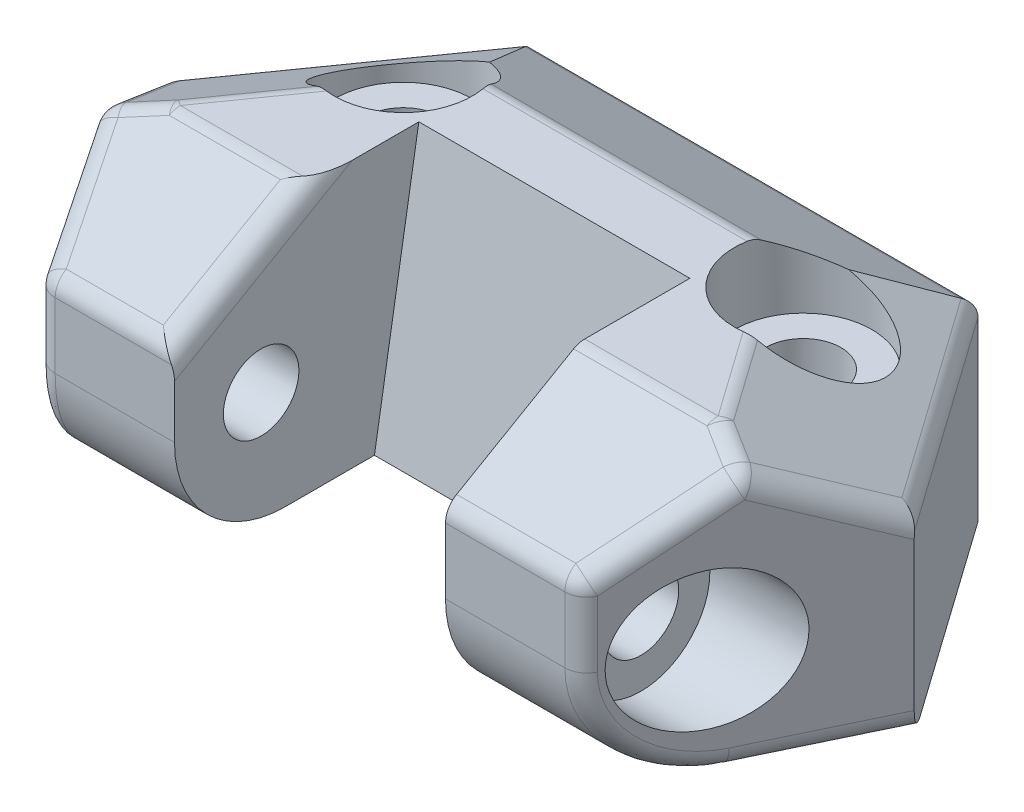
from build123d import *

# Parameters (mm, degrees)
SKETCH_1_R          = 1.7
EXTRUDE_1_DEPTH     = 12
SKETCH_2_R          = 3.1
CUT_EXTRUDE_1_DEPTH = 3.2
SKETCH_3_R          = 1.7
CUT_EXTRUDE_3_DEPTH = 38.553295461
SKETCH_5_R          = 3.1
CUT_EXTRUDE_4_DEPTH = 6
FILLET_1_R          = 5
CHAMFER_6_SIZE      = 3.464101615
CHAMFER_6_SIZE_2    = 6
CHAMFER_7_SIZE      = 6
CHAMFER_7_SIZE2     = 3.464101615
FILLET_2_R          = 1


with BuildPart() as part:
    # Эскиз1 → Бобышка-Вытянуть1 (new body)
    with BuildSketch(Plane(origin=(0, 0, 0), x_dir=(1, 0, 0), z_dir=(0, 1, 0))):
        Polygon((-10.07079442, 9.5), (10.07079442, 9.5), (17, -0.3), (12.1, -10.5), (6.1, -10.5), (6.1, -1.5), (-6.1, -1.5), (-6.1, -10.5), (-12.1, -10.5), (-17, -0.3), align=None)
        with Locations(Location((-9, 2.7, 0), (0, 0, 270))):
            Circle(SKETCH_1_R, mode=Mode.SUBTRACT)
        with Locations(Location((9, 2.7, 0), (0, 0, 90))):
            Circle(SKETCH_1_R, mode=Mode.SUBTRACT)
    extrude(amount=EXTRUDE_1_DEPTH)

    # Эскиз2 → Вырез-Вытянуть1 (cut)
    with BuildSketch(Plane(origin=(0, 12, 0), x_dir=(1, 0, 0), z_dir=(0, 1, 0))):
        with Locations(Location((-9, 2.7, 0), (0, 0, 270))):
            Circle(SKETCH_2_R)
        with Locations(Location((9, 2.7, 0), (0, 0, 270))):
            Circle(SKETCH_2_R)
    extrude(amount=-CUT_EXTRUDE_1_DEPTH, mode=Mode.SUBTRACT)

    # Эскиз3 → Вырез-Вытянуть3 (cut, through all)
    with BuildSketch(Plane(origin=(-17, 0, 0), x_dir=(0, 0, -1), z_dir=(1, 0, 0))):
        with Locations(Location((-6.6, 5, 0), (0, 0, 180))):
            Circle(SKETCH_3_R)
    extrude(amount=CUT_EXTRUDE_3_DEPTH, mode=Mode.SUBTRACT)

    # Эскиз5 → Вырез-Вытянуть4 (cut)
    with BuildSketch(Plane(origin=(-17, 0, 0), x_dir=(0, 0, -1), z_dir=(1, 0, 0))):
        with Locations((-6.6, 5)):
            Circle(SKETCH_5_R)
    cut_extrude_4 = extrude(amount=CUT_EXTRUDE_4_DEPTH, mode=Mode.SUBTRACT)

    # Зеркальное отражение1: Вырез-Вытянуть4 across plane
    add(cut_extrude_4.mirror(Plane(origin=(0, 0, 0), x_dir=(0, 0, 1), z_dir=(1, 0, 0))), mode=Mode.SUBTRACT)

    # Скругление1
    fillet_1_edges = [part.edges().sort_by_distance(p)[0] for p in [
        (9.1, 0, 10.5),
        (-9.1, 0, 10.5),
    ]]
    fillet(fillet_1_edges, radius=FILLET_1_R)

    # Фаска6
    # the kernel refuses this chamfer: 6, 3.464101615 mm, written as the material it takes off along each edge
    with BuildSketch(Plane(origin=(1.109246605, 12, -22.174348821), x_dir=(0.04727114317580557, -0.9983227437537925, -0.0334236192946225), z_dir=(0.577325780445435, 0, 0.8165138965339596)), Plane(origin=(-25.961547814, 12, 12.974348821), x_dir=(-0.047271143175805594, -0.9983227437537925, -0.03342361929462249), z_dir=(0.5773257804454347, 0, -0.8165138965339598))) as chamfer_6_piece_1:
        Polygon((CHAMFER_6_SIZE * 0.998322743793, -CHAMFER_6_SIZE * 0.057893862405), (-CHAMFER_6_SIZE_2 * 0.0578938624027, -CHAMFER_6_SIZE_2 * 0.998322743754), (0, 0), align=None)
    extrude(amount=43.047274261, mode=Mode.SUBTRACT)
    with BuildSketch(Plane(origin=(-25.593308947, 12, -9.5), x_dir=(0, -0.9983227437537927, -0.057893862402670616), z_dir=(1, 0, 0))) as chamfer_6_piece_2:
        Polygon((CHAMFER_6_SIZE * 0.998322743793, -CHAMFER_6_SIZE * 0.057893862405), (-CHAMFER_6_SIZE_2 * 0.0578938624027, -CHAMFER_6_SIZE_2 * 0.998322743754), (0, 0), align=None)
    extrude(amount=51.186617895, mode=Mode.SUBTRACT)

    # Фаска7
    chamfer_7_edges = [part.edges().sort_by_distance(p)[0] for p in [
        (9.1, 12, 10.5),
        (-9.1, 12, 10.5),
    ]]
    chamfer_7_side = [part.faces().sort_by_distance(p)[0] for p in [
        (-6.292671521, 12, -0.620913463),
    ]]
    chamfer(chamfer_7_edges, length=CHAMFER_7_SIZE, length2=CHAMFER_7_SIZE2, reference=chamfer_7_side[0])

    # Скругление2
    fillet_2_edges = [part.edges().sort_by_distance(p)[0] for p in [
        (12.1, 6.767949192, 10.5),
        (15.750980392, 0, 2.9),
        (-15.750980392, 0, 2.9),
        (-12.1, 6.767949192, 10.5),
        (-13.566748408, 11.717448128, 4.989394199),
        (-9.360673072, 12, 4.5),
        (-6.1, 10.267949192, 7.5),
        (-9.1, 8.535898385, 10.5),
        (-13.306075336, 9.98539732, 7.989394199),
        (12.847987818, 1.374258977, 8.942964135),
        (-12.847987818, 1.374258977, 8.942964135),
        (9.360673072, 12, 4.5),
        (11.145926843, 12, 2.413309257),
        (-11.145926843, 12, 2.413309257),
        (0, 12, -3.5),
        (13.566748407, 11.717448128, 4.989394199),
        (9.1, 8.535898385, 10.5),
        (13.306075336, 9.98539732, 7.989394199),
        (15.756075336, 9.98539732, 2.889394199),
        (13.53539721, 8.535898385, -4.6),
        (0, 8.535898385, -9.5),
        (-13.53539721, 8.535898385, -4.6),
        (-17, 4.267949192, 0.3),
        (-15.756075336, 9.98539732, 2.889394199),
    ]]
    fillet(fillet_2_edges, radius=FILLET_2_R)

    # Фаска2
    # the kernel refuses this chamfer: 12, 2 mm, written as the material it takes off along each edge
    with BuildSketch(Plane(origin=(6.1, 12, 1.5), x_dir=(0, -0.9999799892572381, 0.006326222023777778), z_dir=(-1, 0, 0))) as chamfer_2_piece_1:
        with BuildLine():
            Line((12.473718692, 0), (-0.486611265, -2.075874643))
            Line((-0.486611265, -2.075874643), (-0.726606462, -2.07435635))
            ThreePointArc((-0.726606462, -2.07435635), (-0.246571025, -1.037916663), (-0.239995197, 0.001518293))
            Line((-0.239995197, 0.001518293), (0.001518293, 0.239995197))
            ThreePointArc((0.001518293, 0.239995197), (6.238128033, 0.20054023), (12.475236985, 0.239995197))
            Line((12.475236985, 0.239995197), (12.473718692, 0))
        make_face()
    extrude(amount=12.2, mode=Mode.SUBTRACT)


solid = part.part
